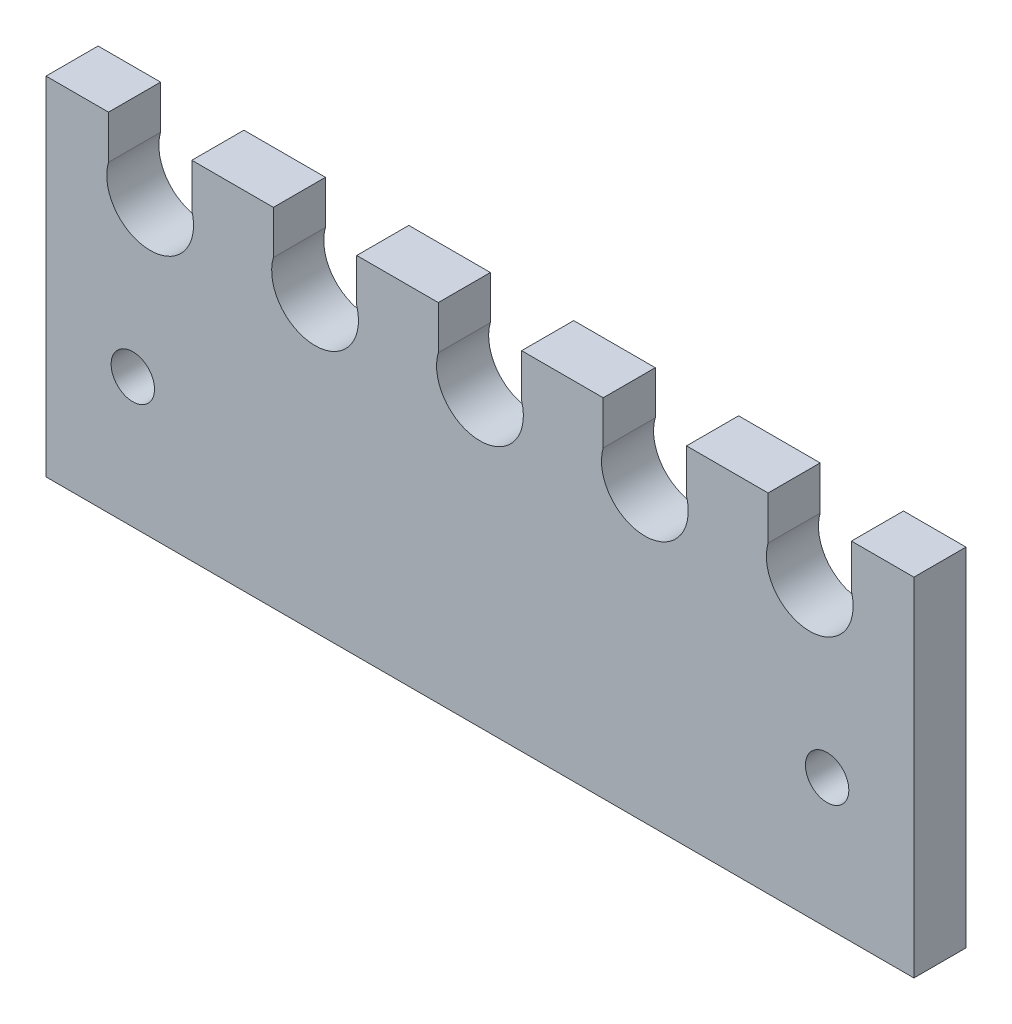
from build123d import *

# Parameters (mm, degrees)
ESQUISSE1_W             = 100
ESQUISSE1_H             = 40
BOSS_EXTRU_1_DEPTH      = 6
ENL_V_MAT_EXTRU_1_DEPTH = 55.184868737
ESQUISSE3_R             = 2.5
ENL_V_MAT_EXTRU_2_DEPTH = 55.184868737


with BuildPart() as part:
    # Esquisse1 → Boss.-Extru.1 (new body)
    with BuildSketch(Plane.XY):
        Rectangle(ESQUISSE1_W, ESQUISSE1_H)
    extrude(amount=BOSS_EXTRU_1_DEPTH)

    # Esquisse2 → Enlèv. mat.-Extru.1 (cut, through all)
    with BuildSketch(Plane.XY.offset(6)):
        with BuildLine():
            Line((-42.8, 15), (-42.8, 20))
            Line((-42.8, 20), (-33.2, 20))
            Line((-33.2, 20), (-33.2, 15))
            ThreePointArc((-33.2, 15), (-38, 8.6), (-42.8, 15))
        make_face()
        with BuildLine():
            Line((-23.8, 15), (-23.8, 20))
            Line((-23.8, 20), (-14.2, 20))
            Line((-14.2, 20), (-14.2, 15))
            ThreePointArc((-14.2, 15), (-19, 8.6), (-23.8, 15))
        make_face()
        with BuildLine():
            Line((-4.8, 15), (-4.8, 20))
            Line((-4.8, 20), (4.8, 20))
            Line((4.8, 20), (4.8, 15))
            ThreePointArc((4.8, 15), (0, 8.6), (-4.8, 15))
        make_face()
        with BuildLine():
            Line((14.2, 15), (14.2, 20))
            Line((14.2, 20), (23.8, 20))
            Line((23.8, 20), (23.8, 15))
            ThreePointArc((23.8, 15), (19, 8.6), (14.2, 15))
        make_face()
        with BuildLine():
            Line((33.2, 15), (33.2, 20))
            Line((33.2, 20), (42.8, 20))
            Line((42.8, 20), (42.8, 15))
            ThreePointArc((42.8, 15), (38, 8.6), (33.2, 15))
        make_face()
    extrude(amount=-ENL_V_MAT_EXTRU_1_DEPTH, mode=Mode.SUBTRACT)

    # Esquisse3 → Enlèv. mat.-Extru.2 (cut, through all)
    with BuildSketch(Plane.XY.offset(6)):
        with Locations((-40, -5)):
            Circle(ESQUISSE3_R)
        with Locations((40, -5)):
            Circle(ESQUISSE3_R)
    extrude(amount=-ENL_V_MAT_EXTRU_2_DEPTH, mode=Mode.SUBTRACT)


solid = part.part
